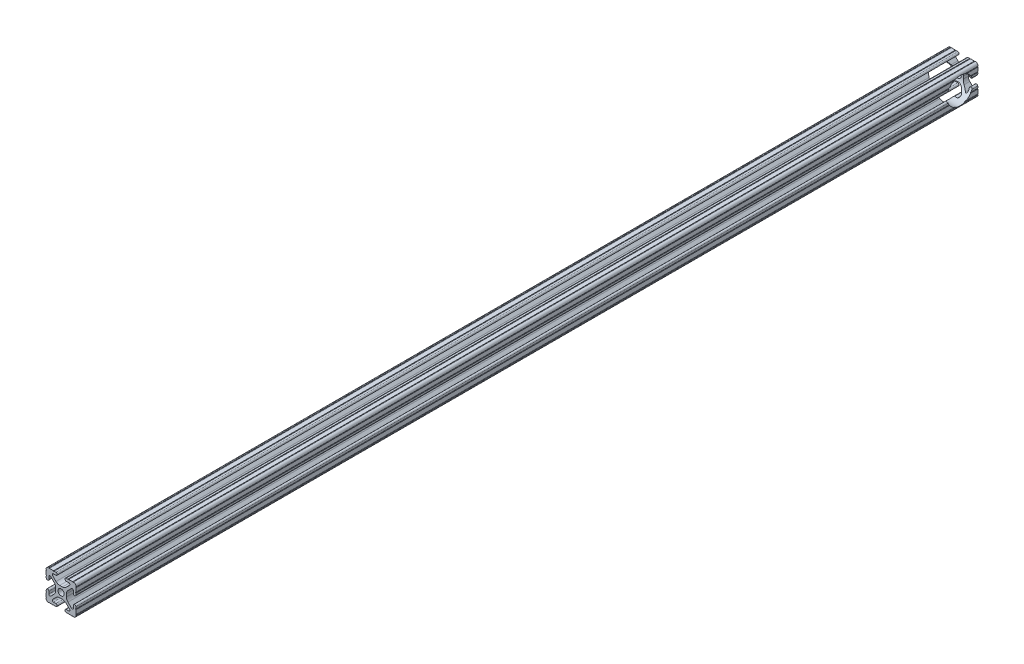
from build123d import *

# Parameters (mm, degrees)
SKETCH3_R               = 2.6035
EXTRUDE1_DEPTH          = 380
CUT_EXTRUDE2_DEPTH      = 381.601395783
CUT_EXTRUDE2_DEPTH_BACK = 381.601395783
SKETCH5_R               = 11


with BuildPart() as part:
    # Sketch3 → Extrude1 (new, symmetric)
    with BuildSketch(Plane.XY):
        with BuildLine():
            Line((-1.115277175, 4.5085), (1.115277175, 4.5085))
            ThreePointArc((1.115277175, 4.5085), (2.806584872, 4.844922018), (4.240406305, 5.80297087))
            Line((4.240406305, 5.80297087), (7.148423664, 8.710988229))
            ThreePointArc((7.148423664, 8.710988229), (7.349906316, 9.772227925), (6.436353897, 10.348636575))
            Line((6.436353897, 10.348636575), (4.381960454, 10.276895575))
            ThreePointArc((4.381960454, 10.276895575), (3.239173075, 11.342562046), (4.304839546, 12.485349424))
            Line((4.304839546, 12.485349424), (5.728246175, 12.535055879))
            ThreePointArc((5.728246175, 12.535055879), (6.054756855, 12.230579745), (6.35923299, 12.557090424))
            Line((6.35923299, 12.557090424), (9.782092278, 12.676619304))
            ThreePointArc((9.782092278, 12.676619304), (10.108602958, 12.37214317), (10.413079092, 12.69865385))
            ThreePointArc((10.413079092, 12.69865385), (12.052764565, 12.052764565), (12.69865385, 10.413079092))
            ThreePointArc((12.69865385, 10.413079092), (12.37214317, 10.108602958), (12.676619304, 9.782092278))
            Line((12.676619304, 9.782092278), (12.557090424, 6.35923299))
            ThreePointArc((12.557090424, 6.35923299), (12.230579745, 6.054756855), (12.535055879, 5.728246175))
            Line((12.535055879, 5.728246175), (12.485349424, 4.304839546))
            ThreePointArc((12.485349424, 4.304839546), (11.342562046, 3.239173075), (10.276895575, 4.381960454))
            Line((10.276895575, 4.381960454), (10.348636575, 6.436353897))
            ThreePointArc((10.348636575, 6.436353897), (9.772227925, 7.349906316), (8.710988229, 7.148423664))
            Line((8.710988229, 7.148423664), (5.80297087, 4.240406305))
            ThreePointArc((5.80297087, 4.240406305), (4.844922018, 2.806584872), (4.5085, 1.115277175))
            Line((4.5085, 1.115277175), (4.5085, -1.115277175))
            ThreePointArc((4.5085, -1.115277175), (4.844922018, -2.806584872), (5.80297087, -4.240406305))
            Line((5.80297087, -4.240406305), (8.710988229, -7.148423664))
            ThreePointArc((8.710988229, -7.148423664), (9.772227925, -7.349906316), (10.348636575, -6.436353897))
            Line((10.348636575, -6.436353897), (10.276895575, -4.381960454))
            ThreePointArc((10.276895575, -4.381960454), (11.342562046, -3.239173075), (12.485349424, -4.304839546))
            Line((12.485349424, -4.304839546), (12.535055879, -5.728246175))
            ThreePointArc((12.535055879, -5.728246175), (12.230579745, -6.054756855), (12.557090424, -6.35923299))
            Line((12.557090424, -6.35923299), (12.676619304, -9.782092278))
            ThreePointArc((12.676619304, -9.782092278), (12.37214317, -10.108602958), (12.69865385, -10.413079092))
            ThreePointArc((12.69865385, -10.413079092), (12.052764565, -12.052764565), (10.413079092, -12.69865385))
            ThreePointArc((10.413079092, -12.69865385), (10.108602958, -12.37214317), (9.782092278, -12.676619304))
            Line((9.782092278, -12.676619304), (6.35923299, -12.557090424))
            ThreePointArc((6.35923299, -12.557090424), (6.054756855, -12.230579745), (5.728246175, -12.535055879))
            Line((5.728246175, -12.535055879), (4.304839546, -12.485349424))
            ThreePointArc((4.304839546, -12.485349424), (3.239173075, -11.342562046), (4.381960454, -10.276895575))
            Line((4.381960454, -10.276895575), (6.436353897, -10.348636575))
            ThreePointArc((6.436353897, -10.348636575), (7.349906316, -9.772227925), (7.148423664, -8.710988229))
            Line((7.148423664, -8.710988229), (4.240406305, -5.80297087))
            ThreePointArc((4.240406305, -5.80297087), (2.806584872, -4.844922018), (1.115277175, -4.5085))
            Line((1.115277175, -4.5085), (-1.115277175, -4.5085))
            ThreePointArc((-1.115277175, -4.5085), (-2.806584872, -4.844922018), (-4.240406305, -5.80297087))
            Line((-4.240406305, -5.80297087), (-7.148423664, -8.710988229))
            ThreePointArc((-7.148423664, -8.710988229), (-7.349906316, -9.772227925), (-6.436353897, -10.348636575))
            Line((-6.436353897, -10.348636575), (-4.381960454, -10.276895575))
            ThreePointArc((-4.381960454, -10.276895575), (-3.239173075, -11.342562046), (-4.304839546, -12.485349424))
            Line((-4.304839546, -12.485349424), (-5.728246175, -12.535055879))
            ThreePointArc((-5.728246175, -12.535055879), (-6.054756855, -12.230579745), (-6.35923299, -12.557090424))
            Line((-6.35923299, -12.557090424), (-9.782092278, -12.676619304))
            ThreePointArc((-9.782092278, -12.676619304), (-10.108602958, -12.37214317), (-10.413079092, -12.69865385))
            ThreePointArc((-10.413079092, -12.69865385), (-12.052764565, -12.052764565), (-12.69865385, -10.413079092))
            ThreePointArc((-12.69865385, -10.413079092), (-12.37214317, -10.108602958), (-12.676619304, -9.782092278))
            Line((-12.676619304, -9.782092278), (-12.557090424, -6.35923299))
            ThreePointArc((-12.557090424, -6.35923299), (-12.230579745, -6.054756855), (-12.535055879, -5.728246175))
            Line((-12.535055879, -5.728246175), (-12.485349424, -4.304839546))
            ThreePointArc((-12.485349424, -4.304839546), (-11.342562046, -3.239173075), (-10.276895575, -4.381960454))
            Line((-10.276895575, -4.381960454), (-10.348636575, -6.436353897))
            ThreePointArc((-10.348636575, -6.436353897), (-9.772227925, -7.349906316), (-8.710988229, -7.148423664))
            Line((-8.710988229, -7.148423664), (-5.80297087, -4.240406305))
            ThreePointArc((-5.80297087, -4.240406305), (-4.844922018, -2.806584872), (-4.5085, -1.115277175))
            Line((-4.5085, -1.115277175), (-4.5085, 1.115277175))
            ThreePointArc((-4.5085, 1.115277175), (-4.844922018, 2.806584872), (-5.80297087, 4.240406305))
            Line((-5.80297087, 4.240406305), (-8.710988229, 7.148423664))
            ThreePointArc((-8.710988229, 7.148423664), (-9.772227925, 7.349906316), (-10.348636575, 6.436353897))
            Line((-10.348636575, 6.436353897), (-10.276895575, 4.381960454))
            ThreePointArc((-10.276895575, 4.381960454), (-11.342562046, 3.239173075), (-12.485349424, 4.304839546))
            Line((-12.485349424, 4.304839546), (-12.535055879, 5.728246175))
            ThreePointArc((-12.535055879, 5.728246175), (-12.230579745, 6.054756855), (-12.557090424, 6.35923299))
            Line((-12.557090424, 6.35923299), (-12.676619304, 9.782092278))
            ThreePointArc((-12.676619304, 9.782092278), (-12.37214317, 10.108602958), (-12.69865385, 10.413079092))
            ThreePointArc((-12.69865385, 10.413079092), (-12.052764565, 12.052764565), (-10.413079092, 12.69865385))
            ThreePointArc((-10.413079092, 12.69865385), (-10.108602958, 12.37214317), (-9.782092278, 12.676619304))
            Line((-9.782092278, 12.676619304), (-6.35923299, 12.557090424))
            ThreePointArc((-6.35923299, 12.557090424), (-6.054756855, 12.230579745), (-5.728246175, 12.535055879))
            Line((-5.728246175, 12.535055879), (-4.304839546, 12.485349424))
            ThreePointArc((-4.304839546, 12.485349424), (-3.239173075, 11.342562046), (-4.381960454, 10.276895575))
            Line((-4.381960454, 10.276895575), (-6.436353897, 10.348636575))
            ThreePointArc((-6.436353897, 10.348636575), (-7.349906316, 9.772227925), (-7.148423664, 8.710988229))
            Line((-7.148423664, 8.710988229), (-4.240406305, 5.80297087))
            ThreePointArc((-4.240406305, 5.80297087), (-2.806584872, 4.844922018), (-1.115277175, 4.5085))
        make_face()
        Circle(SKETCH3_R, mode=Mode.SUBTRACT)
    extrude(amount=EXTRUDE1_DEPTH, both=True)

    # Sketch5 → Cut-Extrude2 (cut, two sides: drawn at the far end of the back side and taken through both)
    with BuildSketch(Plane(origin=(4.5085, 0, 0), x_dir=(0, 0, -1), z_dir=(1, 0, 0)).offset(-CUT_EXTRUDE2_DEPTH_BACK)):
        with Locations((365, 0)):
            Circle(SKETCH5_R)
    extrude(amount=CUT_EXTRUDE2_DEPTH + CUT_EXTRUDE2_DEPTH_BACK, mode=Mode.SUBTRACT)


solid = part.part
